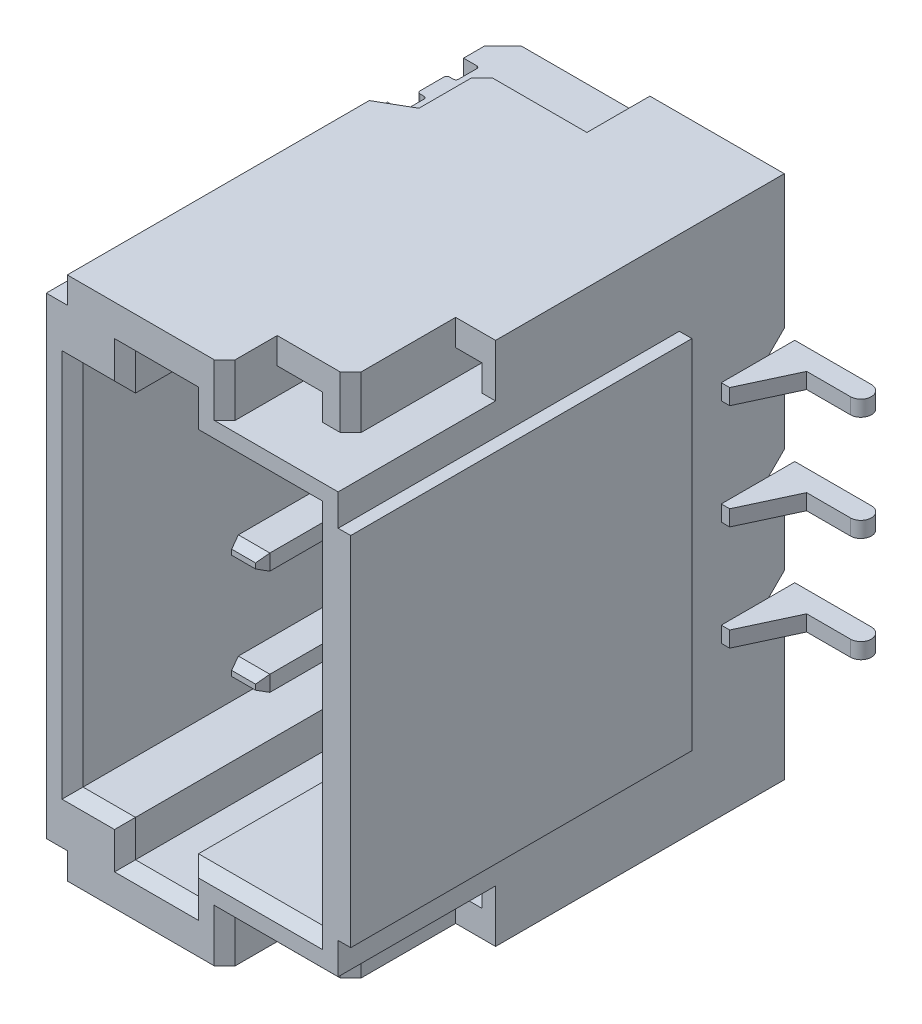
from build123d import *

# Parameters (mm, degrees)
BOSS_EXTRUDE2_START        = -0.815
BOSS_EXTRUDE2_DEPTH        = 0.15
BOSS_EXTRUDE3_START        = 2.26
BOSS_EXTRUDE3_DEPTH        = 0.2
BOSS_EXTRUDE4_START        = 1.76
SKETCH4_W                  = 2.899999619
SKETCH4_H                  = 6
BOSS_EXTRUDE4_DEPTH        = 4.25
SKETCH6_OUTSIDE_W          = 7.998
SKETCH6_OUTSIDE_H          = 9.648
SKETCH6_OUTSIDE_W_2        = 3.400752587
SKETCH6_OUTSIDE_H_2        = 4.399999618
CUT_EXTRUDE3_DEPTH         = 0.12
SKETCH7_W                  = 2.280000687
SKETCH7_H                  = 4.5
CUT_EXTRUDE4_DEPTH         = 3.2
SKETCH8_W                  = 0.600000381
SKETCH8_H                  = 0.349998474
SKETCH8_H_2                = 0.350000382
CUT_EXTRUDE6_DEPTH         = 2.6
CHAMFER1_SIZE              = 0.1
BOSS_EXTRUDE5_START        = -1.82
BOSS_EXTRUDE5_DEPTH        = 0.15
CHAMFER2_SIZE              = 0.1
CHAMFER2_SIZE2             = 0.05
CHAMFER3_SIZE              = 0.05
CHAMFER3_SIZE2             = 0.1
SKETCH10_W                 = 4.538557702
SKETCH10_H                 = 0.25
SKETCH10_W_2               = 4.80487801
CUT_EXTRUDE7_DEPTH         = 0.2
CUT_EXTRUDE8_DEPTH         = 0.5
SKETCH12_W                 = 0.600000143
SKETCH12_H                 = 0.25
CUT_EXTRUDE9_DEPTH         = 1
CHAMFER4_SIZE              = 0.1
CHAMFER5_SIZE              = 0.1
CHAMFER4_OF_MIRROR1_SIZE   = 0.1
CHAMFER5_OF_MIRROR1_SIZE   = 0.1
CUT_EXTRUDE10_DEPTH        = 0.5
CHAMFER6_SIZE              = 0.1
SKETCH14_W                 = 0.431049877
SKETCH14_H                 = 0.25
SKETCH14_W_2               = 0.251151421
CUT_EXTRUDE11_DEPTH        = 2
CHAMFER6_OF_MIRROR3_SIZE   = 0.1
SZKIC1_W                   = 5.019314589
SZKIC1_H                   = 1
WYTNIJ_WYCI_GNI_CIE1_DEPTH = 8.723710007
WYTNIJ_WYCI_GNI_CIE2_DEPTH = 8.723710007
SZYK_LINIOWY1_COUNT        = 2
SZYK_LINIOWY1_PITCH        = 1
SZYK_START                 = 22.630613327
SZYK_LINIOWY2_DEPTH        = 2.779999619
SZYK_LINIOWY3_COUNT        = 3
SZYK_LINIOWY3_PITCH        = 1


# Read off the part's stored shape, not the designer's step: Szyk liniowy2
with BuildPart() as part:
    # Sketch2 → Boss-Extrude2 (new body)
    with BuildSketch(Plane(origin=(0, 0, 0), x_dir=(1, 0, 0), z_dir=(0, 1, 0)).offset(BOSS_EXTRUDE2_START)):
        with BuildLine():
            Line((22.630613327, -2.360296965), (22.630613327, -1.910297036))
            Line((22.630613327, -1.910297036), (25.410614014, -1.910297036))
            Line((25.410614014, -1.910297036), (25.410614014, -1.660297036))
            Line((25.410614014, -1.660297036), (26.140613556, -1.660297036))
            ThreePointArc((26.140613556, -1.660297036), (26.24061352, -1.760297), (26.140613556, -1.860296965))
            Line((26.140613556, -1.860296965), (25.723766327, -1.860296965))
            Line((25.723766327, -1.860296965), (25.490613937, -2.360296965))
            Line((25.490613937, -2.360296965), (22.630613327, -2.360296965))
        make_face()
    extrude(amount=BOSS_EXTRUDE2_DEPTH)


with BuildPart() as body_2:
    # Sketch3 → Boss-Extrude3 (new body)
    with BuildSketch(Plane(origin=(0, 0, 0), x_dir=(1, 0, 0), z_dir=(0, 1, 0)).offset(BOSS_EXTRUDE3_START)):
        with BuildLine():
            Line((22.730613708, -2.960297108), (24.130613327, -2.960297108))
            Line((24.130613327, -2.960297108), (24.130613327, -1.835296988))
            Line((24.130613327, -1.835296988), (23.955612183, -1.660297036))
            Line((23.955612183, -1.660297036), (22.805612564, -1.660297036))
            Line((22.805612564, -1.660297036), (22.630613327, -1.835296988))
            Line((22.630613327, -1.835296988), (22.630613327, -2.035296917))
            Line((22.630613327, -2.035296917), (22.755613327, -2.035296917))
            ThreePointArc((22.755613327, -2.035296917), (22.773290756, -2.042619444), (22.780612946, -2.060297012))
            Line((22.780612946, -2.060297012), (22.780612946, -2.232796907))
            ThreePointArc((22.780612946, -2.232796907), (22.773287217, -2.250482782), (22.755601342, -2.257808511))
            Line((22.755601342, -2.257808511), (22.718101914, -2.257808511))
            ThreePointArc((22.718101914, -2.257808511), (22.700432315, -2.265127499), (22.693113327, -2.282797098))
            Line((22.693113327, -2.282797098), (22.693113327, -2.512797117))
            ThreePointArc((22.693113327, -2.512797117), (22.700435531, -2.530474601), (22.718112946, -2.537796974))
            Line((22.718112946, -2.537796974), (22.755613327, -2.537796974))
            ThreePointArc((22.755613327, -2.537796974), (22.773290895, -2.545119362), (22.780612946, -2.56279707))
            Line((22.780612946, -2.56279707), (22.780612946, -2.735296965))
            ThreePointArc((22.780612946, -2.735296965), (22.773290756, -2.752974533), (22.755613327, -2.76029706))
            Line((22.755613327, -2.76029706), (22.630613327, -2.76029706))
            Line((22.630613327, -2.76029706), (22.630613327, -2.860296965))
            Line((22.630613327, -2.860296965), (22.730613708, -2.960297108))
        make_face()
    extrude(amount=BOSS_EXTRUDE3_DEPTH)


with BuildPart() as body_3:
    # Sketch4 → Boss-Extrude4 (new body)
    with BuildSketch(Plane.XY.offset(BOSS_EXTRUDE4_START)):
        with Locations((24.080613137, -0.240909576)):
            Rectangle(SKETCH4_W, SKETCH4_H)
    extrude(amount=BOSS_EXTRUDE4_DEPTH)

    # Sketch6 outside → Cut-Extrude3 (cut)
    with BuildSketch(Plane(origin=(25.530612946, 0, 0), x_dir=(0, 0, -1), z_dir=(1, 0, 0))):
        with Locations((-3.835, -0.241)):
            Rectangle(SKETCH6_OUTSIDE_W, SKETCH6_OUTSIDE_H)
        with Locations((-4.460673354, -0.24091053)):
            Rectangle(SKETCH6_OUTSIDE_W_2, SKETCH6_OUTSIDE_H_2, mode=Mode.SUBTRACT)
    extrude(amount=-CUT_EXTRUDE3_DEPTH, mode=Mode.SUBTRACT)

    # Sketch7 → Cut-Extrude4 (cut)
    with BuildSketch(Plane.XY.offset(6.01)):
        with Locations((24.020613671, -0.240909576)):
            Rectangle(SKETCH7_W, SKETCH7_H)
    extrude(amount=-CUT_EXTRUDE4_DEPTH, mode=Mode.SUBTRACT)

    # Sketch8 → Cut-Extrude6 (cut)
    with BuildSketch(Plane.XY.offset(6.01)):
        with Locations((23.680613517, 2.184089661)):
            Rectangle(SKETCH8_W, SKETCH8_H)
        with Locations((23.680613517, -2.665909767)):
            Rectangle(SKETCH8_W, SKETCH8_H_2)
    extrude(amount=-CUT_EXTRUDE6_DEPTH, mode=Mode.SUBTRACT)

    # Chamfer1
    chamfer1_edges = [body_3.edges().sort_by_distance(p)[0] for p in [
        (22.880613327, -0.240909576, 6.01),
        (23.130613327, -2.490909576, 6.01),
        (25.160614014, -0.240909576, 6.01),
        (24.570613861, 2.009090424, 6.01),
        (24.570613861, -2.490909576, 6.01),
        (23.130613327, 2.009090424, 6.01),
        (23.380613327, 2.184089661, 6.01),
        (23.980613708, 2.184089661, 6.01),
        (23.680613518, 2.359088898, 6.01),
        (23.380613327, -2.665909767, 6.01),
        (23.680613518, -2.840909958, 6.01),
        (23.980613708, -2.665909767, 6.01),
    ]]
    chamfer(chamfer1_edges, length=CHAMFER1_SIZE)

    # Sketch10 → Cut-Extrude7 (cut)
    with BuildSketch(Plane.ZY.offset(-22.630613327)):
        with Locations((3.741017971, 2.634090424)):
            Rectangle(SKETCH10_W, SKETCH10_H)
        with Locations((3.607857817, -3.115909576)):
            Rectangle(SKETCH10_W_2, SKETCH10_H)
    extrude(amount=-CUT_EXTRUDE7_DEPTH, mode=Mode.SUBTRACT)

    # Sketch11 → Cut-Extrude8 (cut)
    with BuildSketch(Plane.XZ.offset(3.240909576)):
        Polygon((22.630613327, 3.248971939), (23.130613327, 2.960297108), (23.130613327, 2.360296965), (24.130613327, 2.360296965), (24.130613327, 1.643555377), (22.630613327, 1.643555377), align=None)
    cut_extrude8 = extrude(amount=-CUT_EXTRUDE8_DEPTH, mode=Mode.SUBTRACT)

    # Sketch12 → Cut-Extrude9 (cut)
    with BuildSketch(Plane.ZY.offset(-23.130613327)):
        with Locations((2.660297037, -2.865909576)):
            Rectangle(SKETCH12_W, SKETCH12_H)
    cut_extrude9 = extrude(amount=-CUT_EXTRUDE9_DEPTH, mode=Mode.SUBTRACT)

    # Chamfer4
    chamfer4_edges = [body_3.edges().sort_by_distance(p)[0] for p in [
        (22.630613327, -2.740909576, 2.50448597),
    ]]
    chamfer(chamfer4_edges, length=CHAMFER4_SIZE)

    # Chamfer5
    chamfer5_edges = [body_3.edges().sort_by_distance(p)[0] for p in [
        (23.130613327, -3.115909576, 2.360296965),
    ]]
    chamfer(chamfer5_edges, length=CHAMFER5_SIZE)

    # Mirror1: Cut-Extrude8, Cut-Extrude9 across plane
    add(cut_extrude8.mirror(Plane(origin=(0, -0.240909576, 0), x_dir=(0, 0, 1), z_dir=(0, -1, 0))), mode=Mode.SUBTRACT)
    add(cut_extrude9.mirror(Plane(origin=(0, -0.240909576, 0), x_dir=(0, 0, 1), z_dir=(0, -1, 0))), mode=Mode.SUBTRACT)

    # Chamfer4 of Mirror1
    chamfer4_of_mirror1_edges = [body_3.edges().sort_by_distance(p)[0] for p in [
        (22.630613327, 2.259090424, 2.50448597),
    ]]
    chamfer(chamfer4_of_mirror1_edges, length=CHAMFER4_OF_MIRROR1_SIZE)

    # Chamfer5 of Mirror1
    chamfer5_of_mirror1_edges = [body_3.edges().sort_by_distance(p)[0] for p in [
        (23.130613327, 2.634090424, 2.360296965),
    ]]
    chamfer(chamfer5_of_mirror1_edges, length=CHAMFER5_OF_MIRROR1_SIZE)

    # Sketch13 → Cut-Extrude10 (cut)
    with BuildSketch(Plane.XZ.offset(3.240909576)):
        Polygon((24.330612183, 5.510296822), (24.330612183, 6.069555527), (25.671033585, 6.069555527), (25.671033585, 4.510296822), (25.030612946, 4.510296822), (25.030612946, 5.510296822), align=None)
    cut_extrude10 = extrude(amount=-CUT_EXTRUDE10_DEPTH, mode=Mode.SUBTRACT)

    # Chamfer6
    chamfer6_edges = [body_3.edges().sort_by_distance(p)[0] for p in [
        (24.330612183, -2.990909576, 6.01),
        (25.030612946, -2.990909576, 5.510296822),
    ]]
    chamfer(chamfer6_edges, length=CHAMFER6_SIZE)

    # Sketch14 → Cut-Extrude11 (cut)
    with BuildSketch(Plane.XY.offset(5.510296822)):
        with Locations((24.546137122, -2.865909576)):
            Rectangle(SKETCH14_W, SKETCH14_H)
        with Locations((25.156188656, -2.865909576)):
            Rectangle(SKETCH14_W_2, SKETCH14_H)
    cut_extrude11 = extrude(amount=-CUT_EXTRUDE11_DEPTH, mode=Mode.SUBTRACT)

    # Mirror3: Cut-Extrude10, Cut-Extrude11 across plane
    add(cut_extrude10.mirror(Plane(origin=(0, -0.240909576, 0), x_dir=(0, 0, 1), z_dir=(0, -1, 0))), mode=Mode.SUBTRACT)
    add(cut_extrude11.mirror(Plane(origin=(0, -0.240909576, 0), x_dir=(0, 0, 1), z_dir=(0, -1, 0))), mode=Mode.SUBTRACT)

    # Chamfer6 of Mirror3
    chamfer6_of_mirror3_edges = [body_3.edges().sort_by_distance(p)[0] for p in [
        (24.330612183, 2.509090424, 6.01),
        (25.030612946, 2.509090424, 5.510296822),
    ]]
    chamfer(chamfer6_of_mirror3_edges, length=CHAMFER6_OF_MIRROR3_SIZE)

    # Szkic1 → Wytnij-wyciągnięcie1 (cut, through all)
    with BuildSketch(Plane.ZY.offset(-22.630613327)):
        with Locations((4.016954239, -0.240909576)):
            Rectangle(SZKIC1_W, SZKIC1_H)
    extrude(amount=-WYTNIJ_WYCI_GNI_CIE1_DEPTH, mode=Mode.SUBTRACT)


with BuildPart() as body_4:
    # Sketch9 → Boss-Extrude5 (new body)
    with BuildSketch(Plane(origin=(0, 0, 0), x_dir=(1, 0, 0), z_dir=(0, 1, 0)).offset(BOSS_EXTRUDE5_START)):
        Polygon((23.360612869, -2.810297012), (23.660614014, -2.810297012), (23.660614014, -4.910296917), (23.62421608, -5.010296822), (23.397010803, -5.010296822), (23.360612869, -4.910296917), align=None)
    extrude(amount=BOSS_EXTRUDE5_DEPTH)

    # Chamfer2
    chamfer2_edges = [body_4.edges().sort_by_distance(p)[0] for p in [
        (23.510613441, -1.82, 5.010296822),
    ]]
    chamfer2_side = [body_4.faces().sort_by_distance(p)[0] for p in [
        (23.510613441, -1.82, 3.90438183),
    ]]
    chamfer(chamfer2_edges, length=CHAMFER2_SIZE, length2=CHAMFER2_SIZE2, reference=chamfer2_side[0])

    # Chamfer3
    chamfer3_edges = [body_4.edges().sort_by_distance(p)[0] for p in [
        (23.510613441, -1.67, 5.010296822),
    ]]
    chamfer3_side = [body_4.faces().sort_by_distance(p)[0] for p in [
        (23.510613441, -1.72, 5.010296822),
    ]]
    chamfer(chamfer3_edges, length=CHAMFER3_SIZE, length2=CHAMFER3_SIZE2, reference=chamfer3_side[0])


with BuildPart() as body_5:
    # Mirror2: mirrored copy
    add(body_2.part.mirror(Plane(origin=(0, -0.240909576, 0), x_dir=(0, 0, 1), z_dir=(0, -1, 0))))


with BuildPart() as wytnij_wyci_gni_cie1_piece_1:
    # of the separate pieces the step leaves, piece 1, a body of its own (wytnij_wyci_gni_cie1_pieces)
    add(body_3.part.solids().sort_by_distance((24.230612183, 2.759090424, 6.01))[0])


with BuildPart() as wytnij_wyci_gni_cie1_piece_2:
    # of the separate pieces the step leaves, piece 2, a body of its own (wytnij_wyci_gni_cie1_pieces)
    add(body_3.part.solids().sort_by_distance((22.630613327, -2.990909576, 6.01))[0])


with BuildPart() as wytnij_wyci_gni_cie1_piece_1_1:
    # Obiekt-Przenieś/Kopiuj1: moved
    add(wytnij_wyci_gni_cie1_piece_1.part.moved(Location((0, -1, 0))))

    # Połącz1: union Wytnij-wyciągnięcie1 piece 2
    add(wytnij_wyci_gni_cie1_piece_2.part)

    # Sketch5 → Wytnij-wyciągnięcie2 (cut, through all)
    with BuildSketch(Plane.ZY.offset(-22.630613327)):
        Polygon((1.760296941, -0.515910149), (1.910297036, -0.665909767), (2.360296965, -0.665909767), (2.360296965, -0.815909386), (1.910297036, -0.815909386), (1.760296941, -0.965909004), (1.752676685, -0.965909004), (1.752676685, -0.515910149), align=None)
    wytnij_wyci_gni_cie2 = extrude(amount=-WYTNIJ_WYCI_GNI_CIE2_DEPTH, mode=Mode.SUBTRACT)

    # Szyk liniowy1: Wytnij-wyciągnięcie2 ×2
    with Locations(*[(0, i * SZYK_LINIOWY1_PITCH, 0) for i in range(1, SZYK_LINIOWY1_COUNT)]):
        add(wytnij_wyci_gni_cie2, mode=Mode.SUBTRACT)

    # Szyk liniowy2 outline → Szyk liniowy2 (cut)
    with BuildSketch(Plane.YZ.offset(SZYK_START)):
        Polygon((-1.665909767, 1.910297036), (-1.665909767, 2.360296965), (-1.815909386, 2.360296965), (-1.815909386, 1.910297036), (-1.965909004, 1.760296941), (-1.965909004, 1.76), (-1.515910149, 1.76), (-1.515910149, 1.760296941), align=None)
    extrude(amount=SZYK_LINIOWY2_DEPTH, mode=Mode.SUBTRACT)


with BuildPart() as body_2_1:
    # Obiekt-Przenieś/Kopiuj1: moved
    add(body_2.part.moved(Location((0, -1, 0))))


with BuildPart() as body_6:
    # Obiekt-Przenieś/Kopiuj2: copy of part
    add(part.part.moved(Location((0, -1, 0))))


with BuildPart() as body_7:
    # Obiekt-Przenieś/Kopiuj3: copy of part
    add(part.part.moved(Location((0, 1, 0))))


with BuildPart() as szyk_liniowy3_1:
    # Szyk liniowy3: pattern copy
    add(body_4.part.moved(Location(Vector(0, 1, 0) * (1 * SZYK_LINIOWY3_PITCH))))


with BuildPart() as szyk_liniowy3_2:
    # Szyk liniowy3: pattern copy
    add(body_4.part.moved(Location(Vector(0, 1, 0) * (2 * SZYK_LINIOWY3_PITCH))))


solid = Compound([part.part, body_4.part, body_5.part, wytnij_wyci_gni_cie1_piece_1_1.part, body_2_1.part, body_6.part, body_7.part, szyk_liniowy3_1.part, szyk_liniowy3_2.part])
